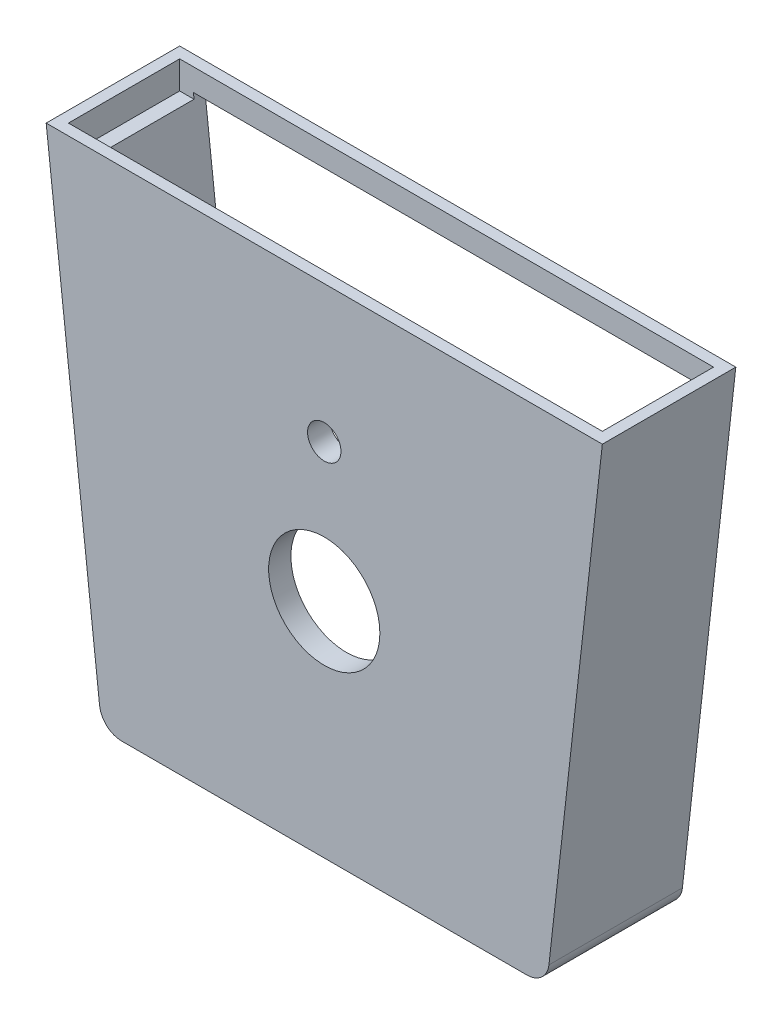
from build123d import *

# Parameters (mm, degrees)
SKETCH1_R           = 3.81
SKETCH1_R_2         = 12.7
BOSS_EXTRUDE1_DEPTH = 5.08
BOSS_EXTRUDE2_DEPTH = 25.4
SKETCH3_W           = 121.92
SKETCH3_H           = 25.4
CUT_EXTRUDE2_DEPTH  = 6.35
BOSS_EXTRUDE3_DEPTH = 2.54
SKETCH5_R           = 1.905
CUT_EXTRUDE3_DEPTH  = 2.54


with BuildPart() as part:
    # Sketch1 → Boss-Extrude1 (new body)
    with BuildSketch(Plane.XY):
        with BuildLine():
            Line((63.5, 56.7961272), (-63.5, 56.7961272))
            Line((-63.5, 56.7961272), (-51.304854459, -52.280570501))
            ThreePointArc((-51.304854459, -52.280570501), (-49.642976536, -55.502534499), (-46.25630987, -56.796126057))
            Line((-46.25630987, -56.796126057), (46.25630987, -56.796126057))
            ThreePointArc((46.25630987, -56.796126057), (49.642976536, -55.502534499), (51.304854459, -52.280570501))
            Line((51.304854459, -52.280570501), (63.5, 56.7961272))
        make_face()
        with Locations((0, 25.51645392)):
            Circle(SKETCH1_R, mode=Mode.SUBTRACT)
        with Locations((0, -5.996126057)):
            Circle(SKETCH1_R_2, mode=Mode.SUBTRACT)
    extrude(amount=-BOSS_EXTRUDE1_DEPTH)

    # Sketch2 → Boss-Extrude2 (add)
    with BuildSketch(Plane.XY.offset(-5.08)):
        with BuildLine():
            Line((63.5, 56.7961272), (-63.5, 56.7961272))
            Line((-63.5, 56.7961272), (-51.304854459, -52.280570501))
            ThreePointArc((-51.304854459, -52.280570501), (-49.642976536, -55.502534499), (-46.25630987, -56.796126057))
            Line((-46.25630987, -56.796126057), (46.25630987, -56.796126057))
            ThreePointArc((46.25630987, -56.796126057), (49.642976536, -55.502534499), (51.304854459, -52.280570501))
            Line((51.304854459, -52.280570501), (63.5, 56.7961272))
        make_face()
        with BuildLine():
            Line((41.712619739, -51.716126057), (-41.712619739, -51.716126057))
            ThreePointArc((-41.712619739, -51.716126057), (-45.099286406, -50.422534499), (-46.761164329, -47.200570501))
            Line((-46.761164329, -47.200570501), (-57.820387337, 51.7161272))
            Line((-57.820387337, 51.7161272), (57.820387337, 51.7161272))
            Line((57.820387337, 51.7161272), (46.761164329, -47.200570501))
            ThreePointArc((46.761164329, -47.200570501), (45.099286406, -50.422534499), (41.712619739, -51.716126057))
        make_face(mode=Mode.SUBTRACT)
    extrude(amount=-BOSS_EXTRUDE2_DEPTH)

    # Sketch3 → Cut-Extrude2 (cut)
    with BuildSketch(Plane(origin=(0, 56.7961272, 0), x_dir=(1, 0, 0), z_dir=(0, 1, 0))):
        with Locations((0, 15.24)):
            Rectangle(SKETCH3_W, SKETCH3_H)
    extrude(amount=-CUT_EXTRUDE2_DEPTH, mode=Mode.SUBTRACT)

    # Sketch4 → Boss-Extrude3 (add)
    with BuildSketch(Plane(origin=(0, 0, -30.48), x_dir=(-1, 0, 0), z_dir=(0, 0, -1))):
        Polygon((-52.99583525, 8.564021488), (-33.94583525, 8.564021488), (-33.94583525, -4.135978512), (-51.575932084, -4.135978512), align=None)
        Polygon((33.94583525, -4.135978512), (51.575932084, -4.135978512), (52.99583525, 8.564021488), (33.94583525, 8.564021488), align=None)
    extrude(amount=-BOSS_EXTRUDE3_DEPTH)

    # Sketch5 → Cut-Extrude3 (cut)
    with BuildSketch(Plane(origin=(0, 0, -30.48), x_dir=(-1, 0, 0), z_dir=(0, 0, -1))):
        with Locations((-43.115859459, 2.214021488)):
            Circle(SKETCH5_R)
        with Locations((43.115859459, 2.214021488)):
            Circle(SKETCH5_R)
    extrude(amount=-CUT_EXTRUDE3_DEPTH, mode=Mode.SUBTRACT)


solid = part.part
